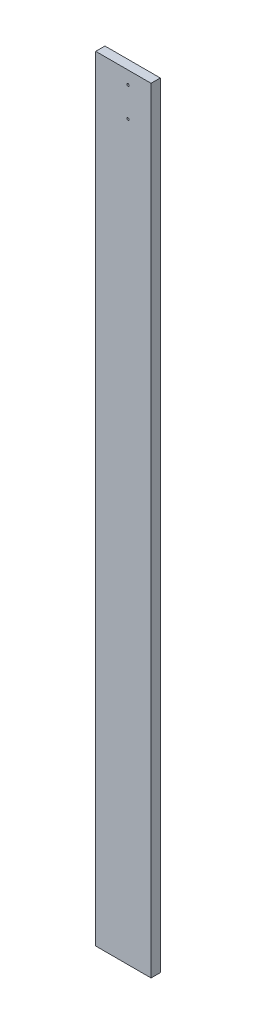
from build123d import *

# Parameters (mm, degrees)
SKETCH1_W           = 38.1
SKETCH1_H           = 533.4
BOSS_EXTRUDE1_DEPTH = 3.175
SKETCH2_R           = 0.79375
CUT_EXTRUDE1_DEPTH  = 294.271022264


with BuildPart() as part:
    # Sketch1 → Boss-Extrude1 (new, symmetric)
    with BuildSketch(Plane.XY):
        with Locations((-6.35, -25.4)):
            Rectangle(SKETCH1_W, SKETCH1_H)
    extrude(amount=BOSS_EXTRUDE1_DEPTH, both=True)

    # Sketch2 → Cut-Extrude1 (cut, through all)
    with BuildSketch(Plane.XY.offset(3.175)):
        with Locations((-3.16, 232.41)):
            Circle(SKETCH2_R)
        with Locations((-3.16, 212.09)):
            Circle(SKETCH2_R)
    extrude(amount=-CUT_EXTRUDE1_DEPTH, mode=Mode.SUBTRACT)


solid = part.part
